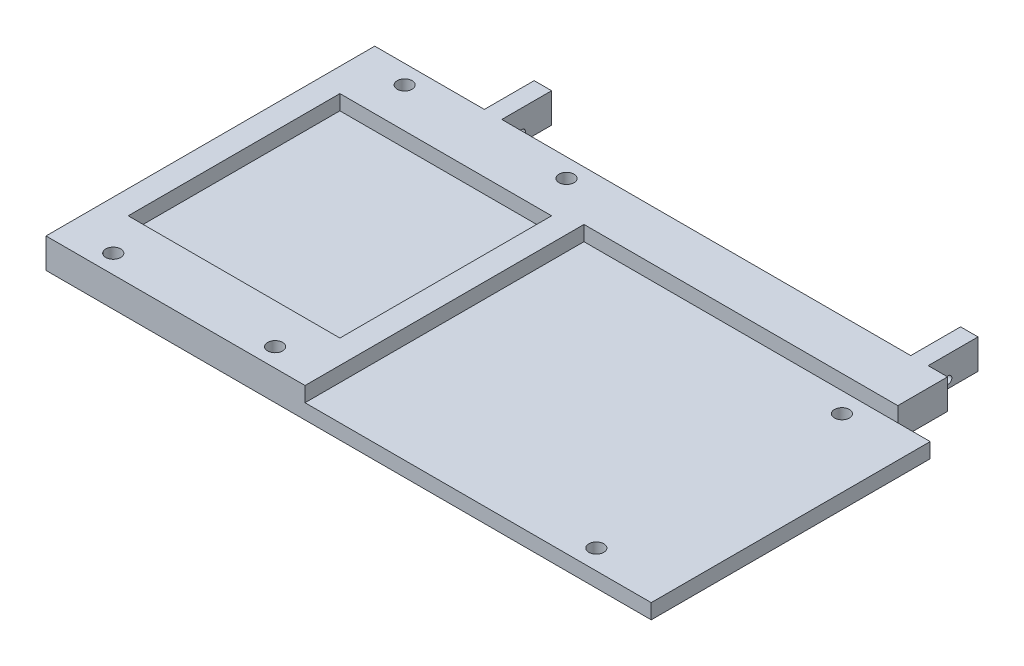
from build123d import *

# Parameters (mm, degrees)
SKETCH1_W           = 52
SKETCH1_H           = 66
BOSS_EXTRUDE1_DEPTH = 6
SKETCH2_W           = 42.5
SKETCH2_H           = 42.5
CUT_EXTRUDE1_DEPTH  = 3
SKETCH3_R           = 1.5
CUT_EXTRUDE2_DEPTH  = 13
SKETCH4_W           = 10
SKETCH4_H           = 6
BOSS_EXTRUDE2_DEPTH = 63
SKETCH5_W           = 3.5
SKETCH5_H           = 6
BOSS_EXTRUDE3_DEPTH = 10
SKETCH6_R           = 0.75
CUT_EXTRUDE3_DEPTH  = 114
SKETCH7_W           = 69.5
SKETCH7_H           = 56
SKETCH7_R           = 1.5
BOSS_EXTRUDE4_DEPTH = 3


with BuildPart() as part:
    # Sketch1 → Boss-Extrude1 (new body)
    with BuildSketch(Plane(origin=(0, 0, 0), x_dir=(1, 0, 0), z_dir=(0, 1, 0))):
        with Locations((-26, -33)):
            Rectangle(SKETCH1_W, SKETCH1_H)
    extrude(amount=BOSS_EXTRUDE1_DEPTH)

    # Sketch2 → Cut-Extrude1 (cut)
    with BuildSketch(Plane(origin=(0, 6, 0), x_dir=(1, 0, 0), z_dir=(0, 1, 0))):
        with Locations((-26, -33)):
            Rectangle(SKETCH2_W, SKETCH2_H)
    extrude(amount=-CUT_EXTRUDE1_DEPTH, mode=Mode.SUBTRACT)

    # Sketch3 → Cut-Extrude2 (cut)
    with BuildSketch(Plane(origin=(0, 6, 0), x_dir=(1, 0, 0), z_dir=(0, 1, 0))):
        with Locations((-42.25, -3.75)):
            Circle(SKETCH3_R)
        with Locations((-9.75, -3.75)):
            Circle(SKETCH3_R)
        with Locations((-9.75, -62.25)):
            Circle(SKETCH3_R)
        with Locations((-42.25, -62.25)):
            Circle(SKETCH3_R)
    extrude(amount=-CUT_EXTRUDE2_DEPTH, mode=Mode.SUBTRACT)

    # Sketch4 → Boss-Extrude2 (add)
    with BuildSketch(Plane(origin=(0, 0, 0), x_dir=(0, 0, -1), z_dir=(1, 0, 0))):
        with Locations((-5, 3)):
            Rectangle(SKETCH4_W, SKETCH4_H)
    extrude(amount=BOSS_EXTRUDE2_DEPTH)

    # Sketch5 → Boss-Extrude3 (add)
    with BuildSketch(Plane(origin=(0, 0, 0), x_dir=(-1, 0, 0), z_dir=(0, 0, -1))):
        with Locations((28.25, 3)):
            Rectangle(SKETCH5_W, SKETCH5_H)
        with Locations((-57.35, 3)):
            Rectangle(SKETCH5_W, SKETCH5_H)
    extrude(amount=BOSS_EXTRUDE3_DEPTH)

    # Sketch6 → Cut-Extrude3 (cut)
    with BuildSketch(Plane(origin=(59.1, 0, 0), x_dir=(0, 0, -1), z_dir=(1, 0, 0))):
        with Locations((4, 1.5)):
            Circle(SKETCH6_R)
    extrude(amount=-CUT_EXTRUDE3_DEPTH, mode=Mode.SUBTRACT)

    # Sketch7 → Boss-Extrude4 (add)
    with BuildSketch(Plane(origin=(0, 0, 0), x_dir=(-1, 0, 0), z_dir=(0, -1, 0))):
        with Locations((-34.75, -38)):
            Rectangle(SKETCH7_W, SKETCH7_H)
        with Locations((-55.8, -14.018024065)):
            Circle(SKETCH7_R, mode=Mode.SUBTRACT)
        with Locations((-54.5, -62.018024065)):
            Circle(SKETCH7_R, mode=Mode.SUBTRACT)
    extrude(amount=-BOSS_EXTRUDE4_DEPTH)


solid = part.part
